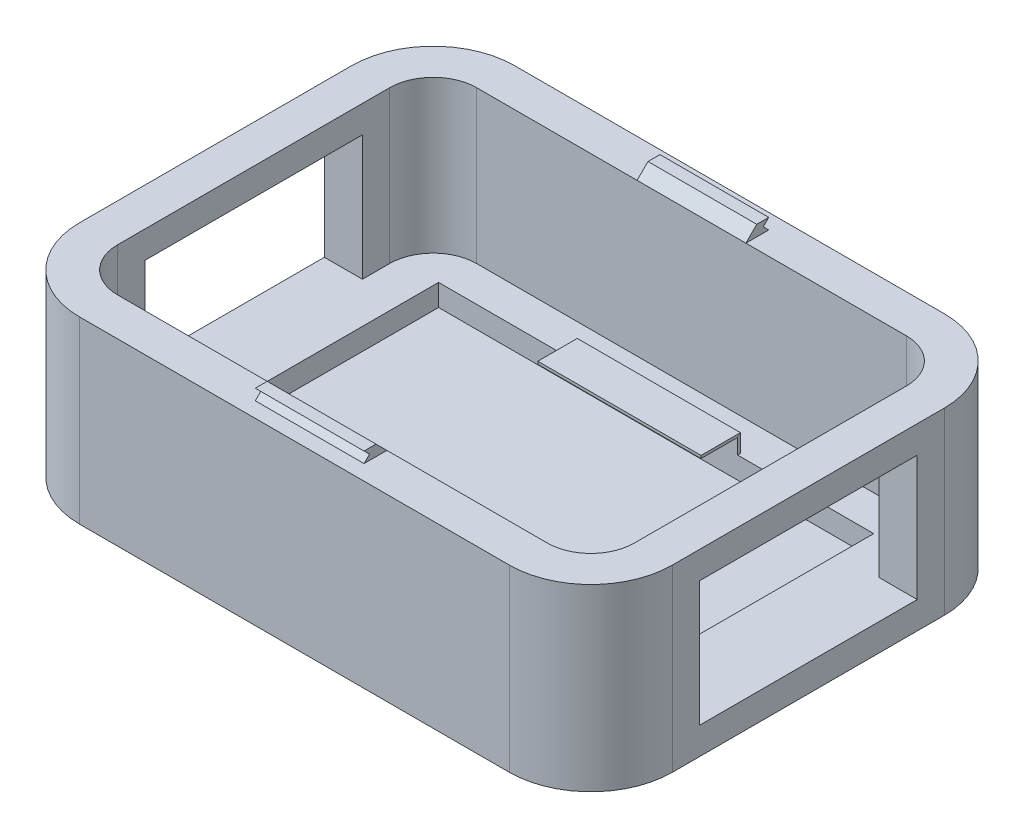
from build123d import *

# Parameters (mm, degrees)
BOSS_EXTRUDE1_DEPTH     = 5
BOSS_EXTRUDE3_DEPTH     = 33
CUT_EXTRUDE2_DEPTH      = 121.706255016
CUT_EXTRUDE2_DEPTH_BACK = 121.706255016
SKETCH7_W               = 40
SKETCH7_H               = 23
CUT_EXTRUDE4_START      = 5
SKETCH3_W               = 80
SKETCH3_H               = 53
CUT_EXTRUDE4_DEPTH      = 4
SKETCH11_W              = 30
SKETCH11_H              = 0.5
SKETCH10_W              = 7
SKETCH10_H              = 0.5
BOSS_EXTRUDE4_START     = -54.5
BOSS_EXTRUDE4_DEPTH     = 20
BOSS_EXTRUDE5_DEPTH     = 20
BOSS_EXTRUDE6_DEPTH     = 10
CHAMFER1_SIZE           = 2


with BuildPart() as part:
    # Sketch1 → Boss-Extrude1 (new body)
    with BuildSketch(Plane(origin=(0, 0, 0), x_dir=(1, 0, 0), z_dir=(0, 1, 0))):
        with BuildLine():
            Line((-39.5, 40), (39.5, 40))
            ThreePointArc((39.5, 40), (50.106601718, 35.606601718), (54.5, 25))
            Line((54.5, 25), (54.5, -25))
            ThreePointArc((54.5, -25), (50.106601718, -35.606601718), (39.5, -40))
            Line((39.5, -40), (-39.5, -40))
            ThreePointArc((-39.5, -40), (-50.106601718, -35.606601718), (-54.5, -25))
            Line((-54.5, -25), (-54.5, 25))
            ThreePointArc((-54.5, 25), (-50.106601718, 35.606601718), (-39.5, 40))
        make_face()
    extrude(amount=BOSS_EXTRUDE1_DEPTH)

    # Sketch1<3> → Boss-Extrude3 (add)
    with BuildSketch(Plane(origin=(0, 0, 0), x_dir=(1, 0, 0), z_dir=(0, 1, 0))):
        with BuildLine():
            Line((-39.5, 40), (39.5, 40))
            ThreePointArc((39.5, 40), (50.106601718, 35.606601718), (54.5, 25))
            Line((54.5, 25), (54.5, -25))
            ThreePointArc((54.5, -25), (50.106601718, -35.606601718), (39.5, -40))
            Line((39.5, -40), (-39.5, -40))
            ThreePointArc((-39.5, -40), (-50.106601718, -35.606601718), (-54.5, -25))
            Line((-54.5, -25), (-54.5, 25))
            ThreePointArc((-54.5, 25), (-50.106601718, 35.606601718), (-39.5, 40))
        make_face()
        with BuildLine():
            ThreePointArc((-39.5, 33), (-45.156854249, 30.656854249), (-47.5, 25))
            Line((-47.5, 25), (-47.5, -25))
            ThreePointArc((-47.5, -25), (-45.156854249, -30.656854249), (-39.5, -33))
            Line((-39.5, -33), (39.5, -33))
            ThreePointArc((39.5, -33), (45.156854249, -30.656854249), (47.5, -25))
            Line((47.5, -25), (47.5, 25))
            ThreePointArc((47.5, 25), (45.156854249, 30.656854249), (39.5, 33))
            Line((39.5, 33), (-39.5, 33))
        make_face(mode=Mode.SUBTRACT)
    extrude(amount=BOSS_EXTRUDE3_DEPTH)

    # Sketch7 → Cut-Extrude2 (cut, two sides: drawn at the far end of the back side and taken through both)
    with BuildSketch(Plane.ZY.offset(54.5).offset(-CUT_EXTRUDE2_DEPTH_BACK)):
        with Locations((0, 16.5)):
            Rectangle(SKETCH7_W, SKETCH7_H)
    extrude(amount=CUT_EXTRUDE2_DEPTH + CUT_EXTRUDE2_DEPTH_BACK, mode=Mode.SUBTRACT)

    # Sketch3 → Cut-Extrude4 (cut)
    with BuildSketch(Plane(origin=(0, 0, 0), x_dir=(1, 0, 0), z_dir=(0, 1, 0)).offset(CUT_EXTRUDE4_START)):
        Rectangle(SKETCH3_W, SKETCH3_H)
    extrude(amount=-CUT_EXTRUDE4_DEPTH, mode=Mode.SUBTRACT)

    # Sweep2: sweep along a path in Sketch13
    with BuildLine(Plane(origin=(0, 0, 0), x_dir=(0, 0, -1), z_dir=(1, 0, 0))) as sweep2_path:
        Line((26.75, 5), (26.75, 8.08))
        Line((26.75, 8.08), (19.75, 8.08))
    # Sketch11 → Sweep2 (sweep)
    with BuildSketch(Plane(origin=(0, 5, 0), x_dir=(1, 0, 0), z_dir=(0, 1, 0))):
        with Locations((0, 26.75)):
            Rectangle(SKETCH11_W, SKETCH11_H)
    sweep(path=sweep2_path.line, transition=Transition.RIGHT)

    # Sweep3: sweep along a path in Sketch12
    with BuildLine(Plane(origin=(0, 0, 0), x_dir=(0, 0, -1), z_dir=(1, 0, 0))) as sweep3_path:
        Line((-26.75, 5), (-26.75, 8.08))
        Line((-26.75, 8.08), (-19.75, 8.08))
    # Sketch10 → Sweep3 (sweep)
    with BuildSketch(Plane(origin=(0, 5, 0), x_dir=(1, 0, 0), z_dir=(0, 1, 0))):
        with Locations((0, -26.75)):
            Rectangle(SKETCH10_W, SKETCH10_H)
    sweep(path=sweep3_path.line, transition=Transition.RIGHT)

    # Sketch19 → Boss-Extrude4 (add, symmetric)
    with BuildSketch(Plane(origin=(54.5, 0, 0), x_dir=(0, 0, -1), z_dir=(1, 0, 0)).offset(BOSS_EXTRUDE4_START)):
        Polygon((36.2, -1), (37.2, 0), (33, 0), (33, -2), (37.2, -2), align=None)
    boss_extrude4 = extrude(amount=BOSS_EXTRUDE4_DEPTH, both=True)

    # Mirror2: Boss-Extrude4 across plane
    add(boss_extrude4.mirror(Plane.XY))

    # Sketch20 → Boss-Extrude5 (add, symmetric)
    with BuildSketch(Plane.XY):
        Polygon((50.7, -1), (51.7, 0), (47.5, 0), (47.5, -2), (51.7, -2), align=None)
    boss_extrude5 = extrude(amount=BOSS_EXTRUDE5_DEPTH, both=True)

    # Mirror3: Boss-Extrude5 across plane
    add(boss_extrude5.mirror(Plane(origin=(0, 0, 0), x_dir=(0, 0, 1), z_dir=(1, 0, 0))))

    # Sketch21 → Boss-Extrude6 (add, symmetric)
    with BuildSketch(Plane(origin=(0, 0, 0), x_dir=(0, 0, -1), z_dir=(1, 0, 0))):
        Polygon((-36.2, 34), (-37.2, 33), (-33, 33), (-33, 35), (-37.2, 35), align=None)
    boss_extrude6 = extrude(amount=BOSS_EXTRUDE6_DEPTH, both=True)

    # Mirror4: Boss-Extrude6 across plane
    add(boss_extrude6.mirror(Plane.XY))

    # Chamfer1
    chamfer1_edges = [part.edges().sort_by_distance(p)[0] for p in [
        (-47.5, -2, 0),
        (0, -2, -33),
        (47.5, -2, 0),
        (0, -2, 33),
        (0, 35, -33),
        (0, 35, 33),
    ]]
    chamfer(chamfer1_edges, length=CHAMFER1_SIZE - 0.0001)  # a hair under: the kernel refuses the full size


solid = part.part
